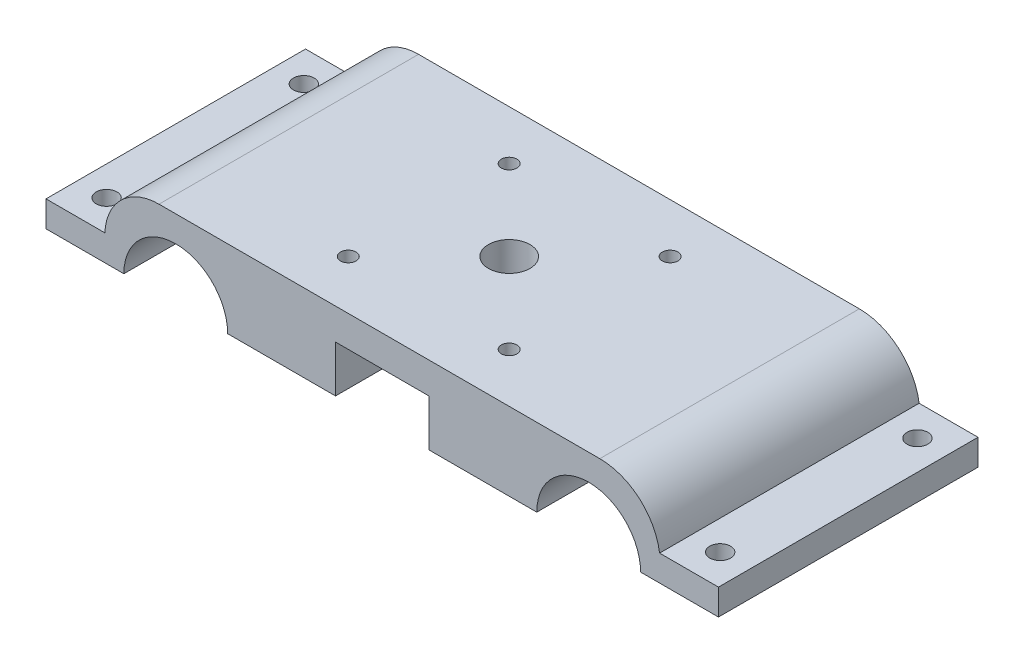
from build123d import *

# Parameters (mm, degrees)
ESTRUSIONE_ESTRUSIONE1_DEPTH = 50
SCHIZZO2_R                   = 2
TAGLIO_ESTRUSIONE1_DEPTH     = 92.821204916
SCHIZZO3_W                   = 18
SCHIZZO3_H                   = 9
TAGLIO_ESTRUSIONE2_DEPTH     = 35
SCHIZZO4_R                   = 4
SCHIZZO4_R_2                 = 1.5
TAGLIO_ESTRUSIONE3_DEPTH     = 93.4993712


with BuildPart() as part:
    # Schizzo1 → Estrusione-Estrusione1 (new body)
    with BuildSketch(Plane.XY):
        with BuildLine():
            Line((-41.361860063, 6.474046711), (18.188139937, 6.474046711))
            ThreePointArc((18.188139937, 6.474046711), (28.188139937, 16.474046711), (38.188139937, 6.474046711))
            Line((38.188139937, 6.474046711), (53.188139937, 6.474046711))
            Line((53.188139937, 6.474046711), (53.188139937, 11.474046711))
            Line((53.188139937, 11.474046711), (41.848393975, 11.474046711))
            ThreePointArc((41.848393975, 11.474046711), (37.956863927, 18.625242568), (30.330074087, 21.474046711))
            Line((30.330074087, 21.474046711), (-54.59096633, 21.474046711))
            ThreePointArc((-54.59096633, 21.474046711), (-61.816076084, 18.57022327), (-65.022114101, 11.474046711))
            Line((-65.022114101, 11.474046711), (-76.361860063, 11.474046711))
            Line((-76.361860063, 11.474046711), (-76.361860063, 6.474046711))
            Line((-76.361860063, 6.474046711), (-61.361860063, 6.474046711))
            ThreePointArc((-61.361860063, 6.474046711), (-51.361860063, 16.474046711), (-41.361860063, 6.474046711))
        make_face()
    extrude(amount=ESTRUSIONE_ESTRUSIONE1_DEPTH)

    # Schizzo2 → Taglio-Estrusione1 (cut, through all)
    with BuildSketch(Plane(origin=(0, 11.474046711, 0), x_dir=(1, 0, 0), z_dir=(0, 1, 0))):
        with Locations((-70.691860063, -6)):
            Circle(SCHIZZO2_R)
        with Locations((-70.691860063, -44)):
            Circle(SCHIZZO2_R)
        with Locations((47.518139937, -6)):
            Circle(SCHIZZO2_R)
        with Locations((47.518139937, -44)):
            Circle(SCHIZZO2_R)
    extrude(amount=-TAGLIO_ESTRUSIONE1_DEPTH, mode=Mode.SUBTRACT)

    # Schizzo3 → Taglio-Estrusione2 (cut)
    with BuildSketch(Plane.XY.offset(50)):
        with Locations((-11.586860063, 10.974046711)):
            Rectangle(SCHIZZO3_W, SCHIZZO3_H)
    extrude(amount=-TAGLIO_ESTRUSIONE2_DEPTH, mode=Mode.SUBTRACT)

    # Schizzo4 → Taglio-Estrusione3 (cut, through all)
    with BuildSketch(Plane(origin=(0, 21.474046711, 0), x_dir=(1, 0, 0), z_dir=(0, 1, 0))):
        with Locations((-12.130446122, -25)):
            Circle(SCHIZZO4_R)
        with Locations((-27.630446122, -9.5)):
            Circle(SCHIZZO4_R_2)
        with Locations((3.369553878, -9.5)):
            Circle(SCHIZZO4_R_2)
        with Locations((3.369553878, -40.5)):
            Circle(SCHIZZO4_R_2)
        with Locations((-27.630446122, -40.5)):
            Circle(SCHIZZO4_R_2)
    extrude(amount=-TAGLIO_ESTRUSIONE3_DEPTH, mode=Mode.SUBTRACT)


solid = part.part
